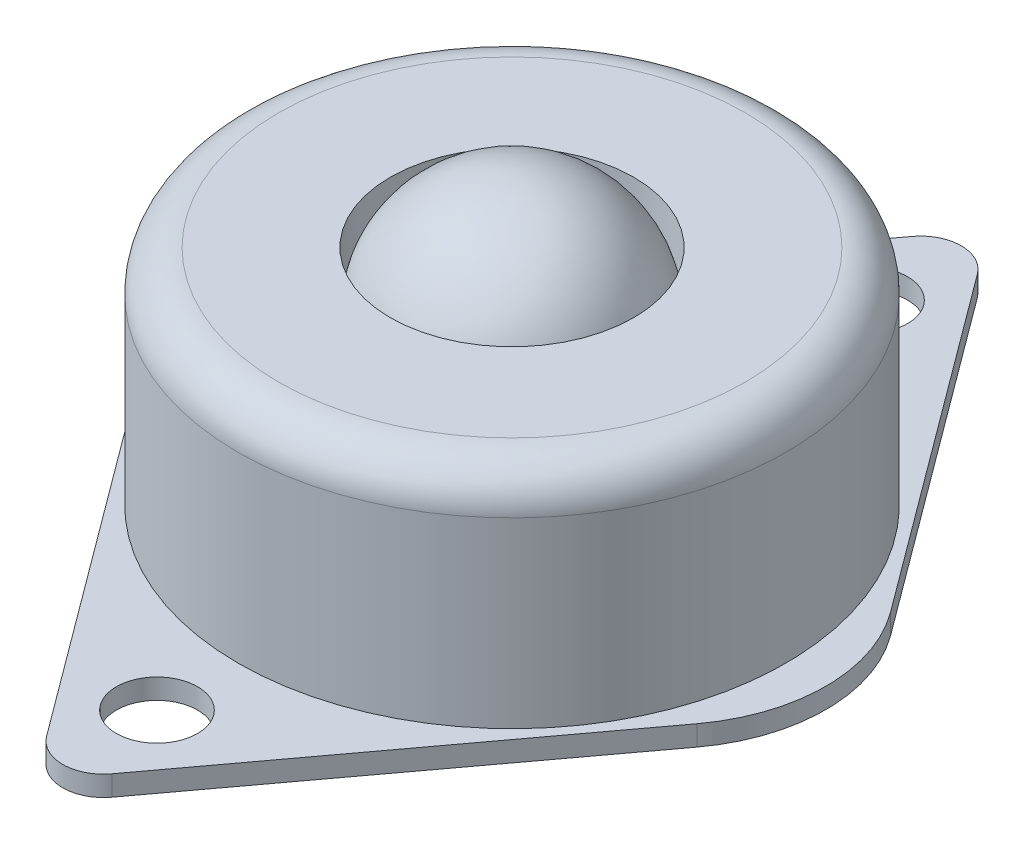
from build123d import *

# Parameters (mm, degrees)
SKETCH_1_R      = 2
EXTRUDE_1_DEPTH = 1
SKETCH_2_R      = 13.5
SKETCH_2_R_2    = 6
EXTRUDE_2_DEPTH = 11
FILLET_1_R      = 2


with BuildPart() as part:
    # 草图1 → 凸台-拉伸1 (new body)
    with BuildSketch(Plane(origin=(0, 0, 0), x_dir=(1, 0, 0), z_dir=(0, 1, 0))):
        with BuildLine():
            ThreePointArc((1.606347752, 21.334346505), (0, 22.142857143), (-1.606347752, 21.334346505))
            Line((-1.606347752, 21.334346505), (-13.895753503, 4.765957447))
            ThreePointArc((-13.895753503, 4.765957447), (-15.470362494, 0), (-13.895753503, -4.765957447))
            Line((-13.895753503, -4.765957447), (-1.606347752, -21.334346505))
            ThreePointArc((-1.606347752, -21.334346505), (0, -22.142857143), (1.606347752, -21.334346505))
            Line((1.606347752, -21.334346505), (13.895753503, -4.765957447))
            ThreePointArc((13.895753503, -4.765957447), (15.470362494, 0), (13.895753503, 4.765957447))
            Line((13.895753503, 4.765957447), (1.606347752, 21.334346505))
        make_face()
        with Locations((0, 17.5)):
            Circle(SKETCH_1_R, mode=Mode.SUBTRACT)
        with Locations((0, -17.5)):
            Circle(SKETCH_1_R, mode=Mode.SUBTRACT)
    extrude(amount=EXTRUDE_1_DEPTH)

    # 草图2 → 凸台-拉伸2 (add)
    with BuildSketch(Plane(origin=(0, 1, 0), x_dir=(1, 0, 0), z_dir=(0, 1, 0))):
        Circle(SKETCH_2_R)
        Circle(SKETCH_2_R_2, mode=Mode.SUBTRACT)
    extrude(amount=EXTRUDE_2_DEPTH)

    # 圆角1
    fillet_1_edges = [part.edges().sort_by_distance(p)[0] for p in [
        (-13.5, 12, 0),
    ]]
    fillet(fillet_1_edges, radius=FILLET_1_R)


with BuildPart() as body_2:
    # 草图5 → 旋转3 (revolve)
    with BuildSketch(Plane(origin=(0, 9, 0), x_dir=(1, 0, 0), z_dir=(0, 1, 0))):
        with BuildLine():
            Line((-6, 0), (6, 0))
            ThreePointArc((6, 0), (0, 6), (-6, 0))
        make_face()
    revolve(axis=Axis((6, 9, 0), (-1, 0, 0)))


solid = Compound([part.part, body_2.part])
